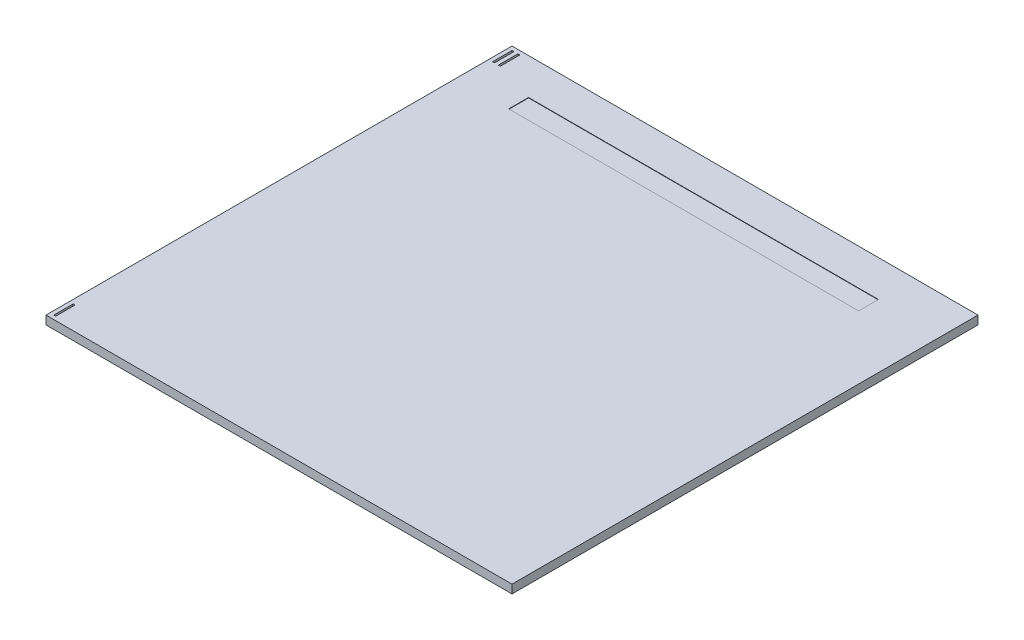
from build123d import *

# Parameters (mm, degrees)
SKETCH2_W           = 304.8
SKETCH2_H           = 304.8
BOSS_EXTRUDE1_DEPTH = 5.588
SKETCH4_W           = 1.27
SKETCH4_H           = 12.7
CUT_EXTRUDE1_DEPTH  = 432.088512656
SKETCH5_W           = 228.854
SKETCH5_H           = 12.954
CUT_EXTRUDE2_DEPTH  = 0.254


with BuildPart() as part:
    # Sketch2 → Boss-Extrude1 (new body)
    with BuildSketch(Plane(origin=(0, 0, 0), x_dir=(1, 0, 0), z_dir=(0, 1, 0))):
        with Locations((152.4, 152.4)):
            Rectangle(SKETCH2_W, SKETCH2_H)
    extrude(amount=BOSS_EXTRUDE1_DEPTH)

    # Sketch4 → Cut-Extrude1 (cut, through all)
    with BuildSketch(Plane(origin=(0, 5.588, 0), x_dir=(1, 0, 0), z_dir=(0, 1, 0))):
        with Locations((3.175, 8.89)):
            Rectangle(SKETCH4_W, SKETCH4_H)
        with Locations((3.175, 295.91)):
            Rectangle(SKETCH4_W, SKETCH4_H)
        with Locations((6.985, 295.91)):
            Rectangle(SKETCH4_W, SKETCH4_H)
    extrude(amount=-CUT_EXTRUDE1_DEPTH, mode=Mode.SUBTRACT)

    # Sketch5 → Cut-Extrude2 (cut)
    with BuildSketch(Plane(origin=(0, 5.588, 0), x_dir=(1, 0, 0), z_dir=(0, 1, 0))):
        with Locations((148.97354, 274.58924)):
            Rectangle(SKETCH5_W, SKETCH5_H)
    extrude(amount=-CUT_EXTRUDE2_DEPTH, mode=Mode.SUBTRACT)


solid = part.part
